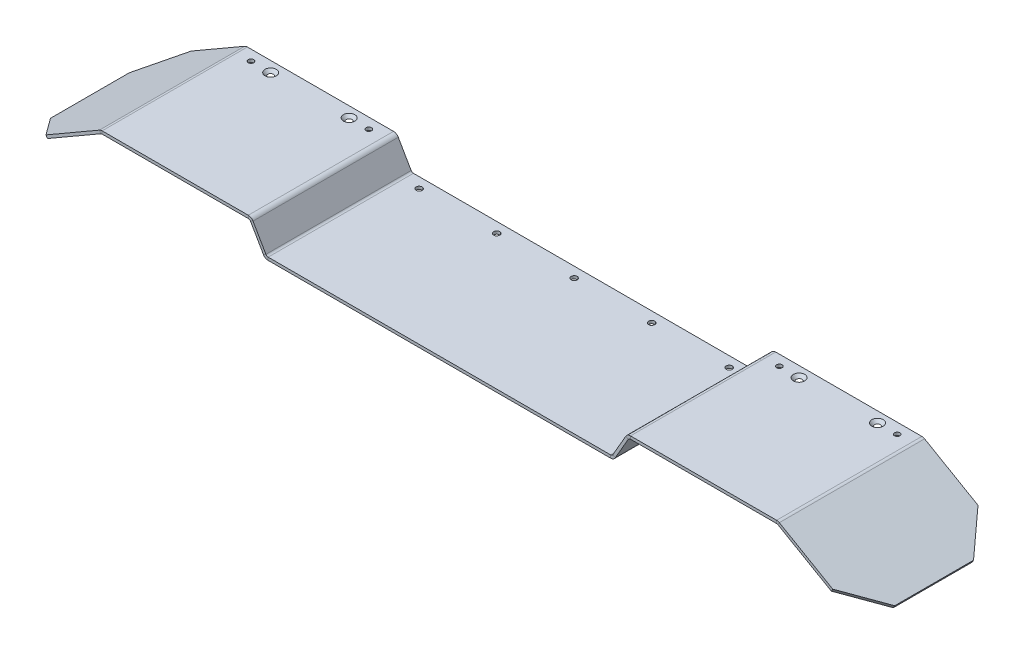
from build123d import *

# Parameters (mm, degrees)
BASE_FLANGE1_DEPTH = 166.61684
SKETCH2_R          = 3.5
CUT_EXTRUDE1_DEPTH = 3.26
CHAMFER1_SIZE      = 38.1
SKETCH3_R          = 3
CUT_EXTRUDE2_DEPTH = 3.26
SKETCH8_R          = 3.125
CUT_EXTRUDE7_DEPTH = 10
CHAMFER2_SIZE      = 3.5


# Sheet-metal steps are written as plain solids
with BuildPart() as part:
    # Sketch1 → Base-Flange1 (new body)
    with BuildSketch(Plane.XY):
        with BuildLine():
            Line((-482.6, -24.572383929), (-388.340998066, 29.848076211))
            ThreePointArc((-388.340998066, 29.848076211), (-387.617455201, 30.147777479), (-386.840998066, 30.25))
            Line((-386.840998066, 30.25), (-219.196896451, 30.25))
            ThreePointArc((-219.196896451, 30.25), (-217.696896451, 29.848076211), (-216.598820239, 28.75))
            Line((-216.598820239, 28.75), (-201.807106343, 3.13))
            ThreePointArc((-201.807106343, 3.13), (-199.515787315, 0.838680972), (-196.385787315, 0))
            Line((-196.385787315, 0), (196.385787315, 0))
            ThreePointArc((196.385787315, 0), (199.515787315, 0.838680972), (201.807106343, 3.13))
            Line((201.807106343, 3.13), (216.598820239, 28.75))
            ThreePointArc((216.598820239, 28.75), (217.696896451, 29.848076211), (219.196896451, 30.25))
            Line((219.196896451, 30.25), (386.840998066, 30.25))
            ThreePointArc((386.840998066, 30.25), (387.617455201, 30.147777479), (388.340998066, 29.848076211))
            Line((388.340998066, 29.848076211), (482.6, -24.572383929))
            Line((482.6, -24.572383929), (484.23, -21.749141113))
            Line((484.23, -21.749141113), (389.970998066, 32.671319028))
            ThreePointArc((389.970998066, 32.671319028), (388.461205288, 33.296695673), (386.840998066, 33.51))
            Line((386.840998066, 33.51), (219.196896451, 33.51))
            ThreePointArc((219.196896451, 33.51), (216.066896451, 32.671319028), (213.775577423, 30.38))
            Line((213.775577423, 30.38), (198.983863526, 4.76))
            ThreePointArc((198.983863526, 4.76), (197.885787315, 3.661923789), (196.385787315, 3.26))
            Line((196.385787315, 3.26), (-196.385787315, 3.26))
            ThreePointArc((-196.385787315, 3.26), (-197.885787315, 3.661923789), (-198.983863526, 4.76))
            Line((-198.983863526, 4.76), (-213.775577423, 30.38))
            ThreePointArc((-213.775577423, 30.38), (-216.066896451, 32.671319028), (-219.196896451, 33.51))
            Line((-219.196896451, 33.51), (-386.840998066, 33.51))
            ThreePointArc((-386.840998066, 33.51), (-388.461205288, 33.296695673), (-389.970998066, 32.671319028))
            Line((-389.970998066, 32.671319028), (-484.23, -21.749141113))
            Line((-484.23, -21.749141113), (-482.6, -24.572383929))
        make_face()
    extrude(amount=BASE_FLANGE1_DEPTH)

    # Sketch2 → Cut-Extrude1 (cut)
    with BuildSketch(Plane(origin=(0, 3.26, 0), x_dir=(1, 0, 0), z_dir=(0, 1, 0))):
        with Locations(Location((0, -11.96, 0), (0, 0, 270))):
            Circle(SKETCH2_R)
        with Locations(Location((-177.8, -11.96, 0), (0, 0, 270))):
            Circle(SKETCH2_R)
        with Locations(Location((-88.9, -11.96, 0), (0, 0, 270))):
            Circle(SKETCH2_R)
        with Locations(Location((88.9, -11.96, 0), (0, 0, 270))):
            Circle(SKETCH2_R)
        with Locations(Location((177.8, -11.96, 0), (0, 0, 270))):
            Circle(SKETCH2_R)
    extrude(amount=-CUT_EXTRUDE1_DEPTH, mode=Mode.SUBTRACT)

    # Chamfer1
    chamfer1_edges = [part.edges().sort_by_distance(p)[0] for p in [
        (-483.415, -23.160762521, 166.61684),
        (-483.415, -23.160762521, 0),
        (483.415, -23.160762521, 0),
        (483.415, -23.160762521, 166.61684),
    ]]
    chamfer(chamfer1_edges, length=CHAMFER1_SIZE)

    # Sketch3 → Cut-Extrude2 (cut)
    with BuildSketch(Plane(origin=(0, 33.51, 0), x_dir=(1, 0, 0), z_dir=(0, 1, 0))):
        with Locations(Location((-258.045033443, -12.066000028, 0), (0, 0, 180))):
            Circle(SKETCH3_R)
        with Locations(Location((-348.045033443, -12.066000028, 0), (0, 0, 180))):
            Circle(SKETCH3_R)
        with Locations(Location((258.045033443, -12.066000028, 0), (0, 0, 180))):
            Circle(SKETCH3_R)
        with Locations(Location((348.045033443, -12.066000028, 0), (0, 0, 180))):
            Circle(SKETCH3_R)
    extrude(amount=-CUT_EXTRUDE2_DEPTH, mode=Mode.SUBTRACT)

    # Sketch8 → Cut-Extrude7 (cut)
    with BuildSketch(Plane(origin=(0, 33.51, 0), x_dir=(1, 0, 0), z_dir=(0, 1, 0))):
        with Locations(Location((235.448800169, -12.066000028, 0), (0, 0, 180))):
            Circle(SKETCH8_R)
        with Locations(Location((370.641266718, -12.066000028, 0), (0, 0, 180))):
            Circle(SKETCH8_R)
        with Locations(Location((-370.641266718, -12.066000028, 0), (0, 0, 180))):
            Circle(SKETCH8_R)
        with Locations(Location((-235.448800169, -12.066000028, 0), (0, 0, 180))):
            Circle(SKETCH8_R)
    extrude(amount=-CUT_EXTRUDE7_DEPTH, mode=Mode.SUBTRACT)

    # Chamfer2
    # the kernel refuses this chamfer: 3.5 mm, written as the material it takes off along each edge
    with BuildSketch(Plane(origin=(-348.045033443, 33.51, 12.066000028), x_dir=(-1, 0, 0), z_dir=(0, 0, -1))) as chamfer2_piece_1:
        Polygon((3 + CHAMFER2_SIZE, 0), (3, -CHAMFER2_SIZE), (3, 0), align=None)
    revolve(axis=Axis((-348.045033443, 33.51, 12.066000028), (0, 1, 0)), mode=Mode.SUBTRACT)
    with BuildSketch(Plane(origin=(-258.045033443, 33.51, 12.066000028), x_dir=(-1, 0, 0), z_dir=(0, 0, -1))) as chamfer2_piece_2:
        Polygon((3 + CHAMFER2_SIZE, 0), (3, -CHAMFER2_SIZE), (3, 0), align=None)
    revolve(axis=Axis((-258.045033443, 33.51, 12.066000028), (0, 1, 0)), mode=Mode.SUBTRACT)
    with BuildSketch(Plane(origin=(348.045033443, 33.51, 12.066000028), x_dir=(-1, 0, 0), z_dir=(0, 0, -1))) as chamfer2_piece_3:
        Polygon((3 + CHAMFER2_SIZE, 0), (3, -CHAMFER2_SIZE), (3, 0), align=None)
    revolve(axis=Axis((348.045033443, 33.51, 12.066000028), (0, 1, 0)), mode=Mode.SUBTRACT)
    with BuildSketch(Plane(origin=(258.045033443, 33.51, 12.066000028), x_dir=(-1, 0, 0), z_dir=(0, 0, -1))) as chamfer2_piece_4:
        Polygon((3 + CHAMFER2_SIZE, 0), (3, -CHAMFER2_SIZE), (3, 0), align=None)
    revolve(axis=Axis((258.045033443, 33.51, 12.066000028), (0, 1, 0)), mode=Mode.SUBTRACT)


solid = part.part
